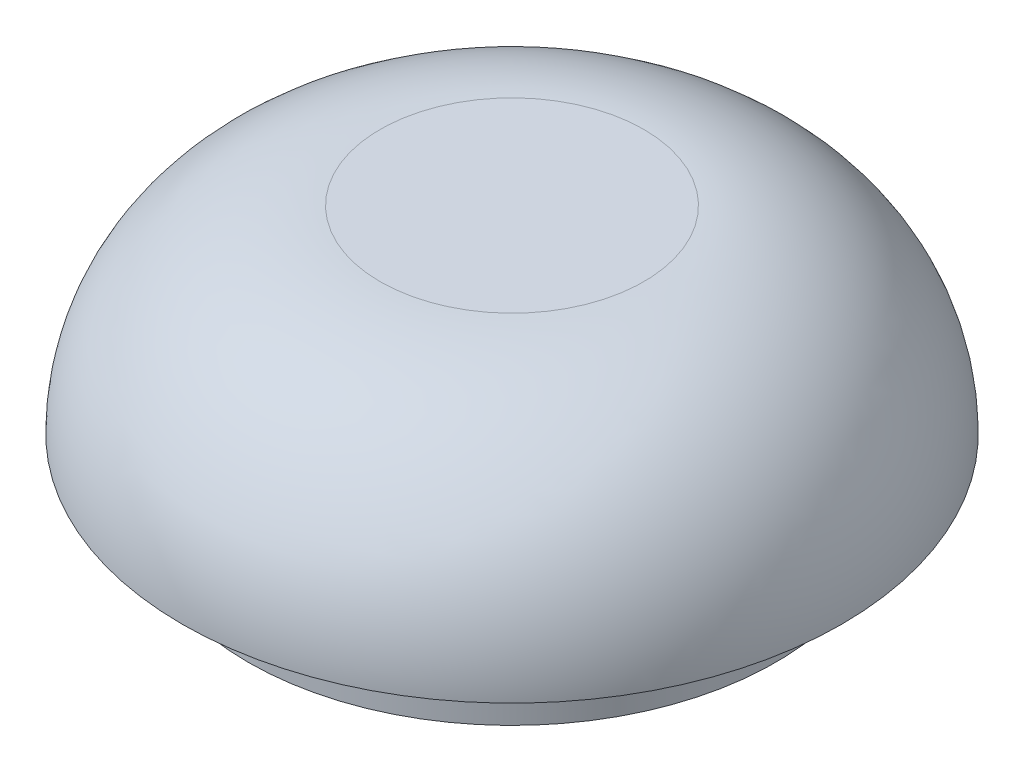
from build123d import *

# Parameters (mm, degrees)
SKETCH1_R           = 5
BOSS_EXTRUDE1_DEPTH = 3
SKETCH2_R           = 4
BOSS_EXTRUDE2_DEPTH = 1
FILLET1_R           = 3


with BuildPart() as part:
    # Sketch1 → Boss-Extrude1 (new body)
    with BuildSketch(Plane(origin=(0, 0, 0), x_dir=(1, 0, 0), z_dir=(0, 1, 0))):
        with Locations(Location((0, 0, 0), (0, 0, 270))):
            Circle(SKETCH1_R)
    extrude(amount=BOSS_EXTRUDE1_DEPTH)

    # Sketch2 → Boss-Extrude2 (add)
    with BuildSketch(Plane.XZ):
        with Locations(Location((0, 0, 0), (0, 0, 270))):
            Circle(SKETCH2_R)
    extrude(amount=BOSS_EXTRUDE2_DEPTH)

    # Fillet1
    fillet1_edges = [part.edges().sort_by_distance(p)[0] for p in [
        (0, 3, -5),
    ]]
    fillet(fillet1_edges, radius=FILLET1_R - 0.0001)  # a hair under: the kernel refuses the full size


solid = part.part
